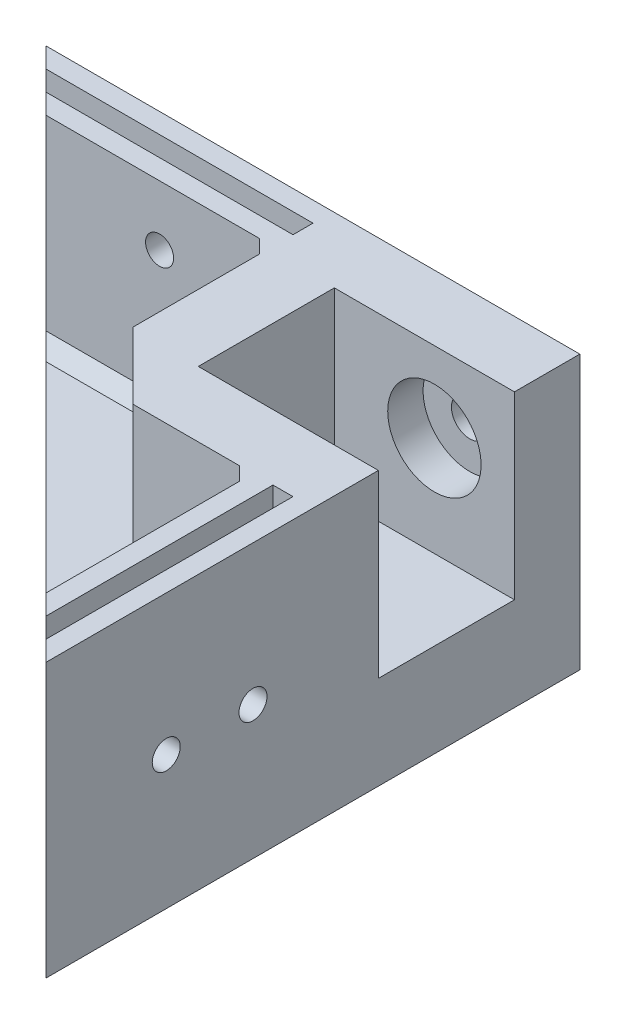
from build123d import *

# Parameters (mm, degrees)
SZKIC1_W                        = 37
SZKIC1_H                        = 30
DODANIE_WYCI_GNI_CIE1_DEPTH     = 40
SZKIC2_W                        = 27
SZKIC2_H                        = 20.4
WYTNIJ_WYCI_GNI_CIE1_DEPTH      = 30
WYTNIJ_WYCI_GNI_CIE2_DEPTH      = 15.5
WYTNIJ_WYCI_GNI_CIE2_DEPTH_BACK = 15.5
SZKIC3_R                        = 7
SZKIC4_R                        = 2.75
WYTNIJ_WYCI_GNI_CIE3_DEPTH      = 63.20128616
SZKIC5_W                        = 27
SZKIC5_H                        = 20.4
DODANIE_WYCI_GNI_CIE2_DEPTH     = 3
DODANIE_WYCI_GNI_CIE3_DEPTH     = 10
SZKIC8_W                        = 74
SZKIC8_H                        = 3
WYTNIJ_WYCI_GNI_CIE4_DEPTH      = 77
DODANIE_WYCI_GNI_CIE4_DEPTH     = 30
DODANIE_WYCI_GNI_CIE5_DEPTH     = 30
SZKIC11_R                       = 2.1
SZKIC11_R_2                     = 3.1
WYTNIJ_WYCI_GNI_CIE5_DEPTH      = 77
SZKIC12_R                       = 2.1
WYTNIJ_WYCI_GNI_CIE6_DEPTH      = 77
SFAZOWANIE2_SIZE                = 10
SFAZOWANIE3_SIZE                = 2
SZKIC13_R                       = 2.1
WYTNIJ_WYCI_GNI_CIE7_DEPTH      = 77
SZKIC14_R                       = 3.1
SZKIC14_R_2                     = 2.1
DODANIE_WYCI_GNI_CIE6_DEPTH     = 1


with BuildPart() as part:
    # Szkic1 → Dodanie-wyciągnięcie1 (new body)
    with BuildSketch(Plane.XY):
        with Locations((18.5, 15)):
            Rectangle(SZKIC1_W, SZKIC1_H)
    extrude(amount=DODANIE_WYCI_GNI_CIE1_DEPTH)

    # Szkic2 → Wytnij-wyciągnięcie1 (cut)
    with BuildSketch(Plane(origin=(0, 30, 0), x_dir=(1, 0, 0), z_dir=(0, 1, 0))):
        with Locations((23.5, -20)):
            Rectangle(SZKIC2_W, SZKIC2_H)
    extrude(amount=-WYTNIJ_WYCI_GNI_CIE1_DEPTH, mode=Mode.SUBTRACT)

    # Szkic3 → Wytnij-wyciągnięcie2 (cut, two sides: drawn at the far end of the back side and taken through both)
    with BuildSketch(Plane.XY.offset(20).offset(-WYTNIJ_WYCI_GNI_CIE2_DEPTH_BACK)):
        with Locations(Location((25, 18, 0), (0, 0, 180))):
            Circle(SZKIC3_R)
    extrude(amount=WYTNIJ_WYCI_GNI_CIE2_DEPTH + WYTNIJ_WYCI_GNI_CIE2_DEPTH_BACK, mode=Mode.SUBTRACT)

    # Szkic4 → Wytnij-wyciągnięcie3 (cut, through all)
    with BuildSketch(Plane(origin=(0, 0, 0), x_dir=(-1, 0, 0), z_dir=(0, 0, -1))):
        with Locations((-25, 18)):
            Circle(SZKIC4_R)
    extrude(amount=-WYTNIJ_WYCI_GNI_CIE3_DEPTH, mode=Mode.SUBTRACT)

    # Szkic5 → Dodanie-wyciągnięcie2 (add)
    with BuildSketch(Plane.XZ):
        with Locations((23.5, 20)):
            Rectangle(SZKIC5_W, SZKIC5_H)
    extrude(amount=-DODANIE_WYCI_GNI_CIE2_DEPTH)

    # Szkic6 → Dodanie-wyciągnięcie3 (add)
    with BuildSketch(Plane.XZ):
        Polygon((37, 0), (-43, 0), (37, 80), align=None)
    extrude(amount=DODANIE_WYCI_GNI_CIE3_DEPTH)

    # Szkic8 → Wytnij-wyciągnięcie4 (cut)
    with BuildSketch(Plane(origin=(0, 0, 80), x_dir=(-1, 0, 0), z_dir=(0, 0, -1))):
        with Locations((3, -5)):
            Rectangle(SZKIC8_W, SZKIC8_H)
    extrude(amount=WYTNIJ_WYCI_GNI_CIE4_DEPTH, mode=Mode.SUBTRACT)

    # Szkic9 → Dodanie-wyciągnięcie4 (add)
    with BuildSketch(Plane(origin=(0, 0, 0), x_dir=(1, 0, 0), z_dir=(0, 1, 0))):
        Polygon((0, 0), (-43, 0), (-40, -3), (0, -3), align=None)
        Polygon((0, -6), (0, -9), (-34, -9), (-37, -6), align=None)
    extrude(amount=DODANIE_WYCI_GNI_CIE4_DEPTH)

    # Szkic10 → Dodanie-wyciągnięcie5 (add)
    with BuildSketch(Plane(origin=(0, 0, 0), x_dir=(1, 0, 0), z_dir=(0, 1, 0))):
        Polygon((31, -74), (31, -40), (28, -40), (28, -71), align=None)
        Polygon((37, -80), (37, -40), (34, -40), (34, -77), align=None)
    extrude(amount=DODANIE_WYCI_GNI_CIE5_DEPTH)

    # Szkic11 → Wytnij-wyciągnięcie5 (cut)
    with BuildSketch(Plane(origin=(0, 0, 0), x_dir=(1, 0, 0), z_dir=(0, 1, 0))):
        with Locations((-7, -16)):
            Circle(SZKIC11_R)
        with Locations((21, -47)):
            Circle(SZKIC11_R_2)
    extrude(amount=-WYTNIJ_WYCI_GNI_CIE5_DEPTH, mode=Mode.SUBTRACT)

    # Szkic12 → Wytnij-wyciągnięcie6 (cut)
    with BuildSketch(Plane.XY.offset(9)):
        with Locations((-17, 21)):
            Circle(SZKIC12_R)
        with Locations((-17, 9)):
            Circle(SZKIC12_R)
    extrude(amount=-WYTNIJ_WYCI_GNI_CIE6_DEPTH, mode=Mode.SUBTRACT)

    # Sfazowanie2
    sfazowanie2_edges = [part.edges().sort_by_distance(p)[0] for p in [
        (0, 15, 40),
    ]]
    chamfer(sfazowanie2_edges, length=SFAZOWANIE2_SIZE)

    # Sfazowanie3
    # the kernel refuses this chamfer: 2 mm, written as the material it adds along each edge
    with BuildSketch(Plane(origin=(-1.333333333, 1.333333333, 10.333333333), x_dir=(0.7071067811865475, 0.7071067811865475, 0), z_dir=(0.5773502691896258, -0.5773502691896258, -0.5773502691896256))) as sfazowanie3_piece_1_section:
        Polygon((-1.414213562, 0.816496581), (1.414213562, 0.816496581), (0, -1.632993162), align=None)
    sfazowanie3_piece_1 = extrude(amount=2.540341184, mode=Mode.PRIVATE)
    sfazowanie3_piece_1 = split(sfazowanie3_piece_1, bisect_by=Plane(origin=(0, 0, 9), z_dir=(0, 1, 0)), keep=Keep.TOP, mode=Mode.PRIVATE)
    sfazowanie3_piece_1 = split(sfazowanie3_piece_1, bisect_by=Plane(origin=(0, 0, 9), z_dir=(-1, 0, 0)), keep=Keep.TOP, mode=Mode.PRIVATE)
    sfazowanie3_piece_1 = split(sfazowanie3_piece_1, bisect_by=Plane(origin=(0, 0, 9), z_dir=(0, 0, 1)), keep=Keep.TOP, mode=Mode.PRIVATE)
    add(sfazowanie3_piece_1)
    with BuildSketch(Plane(origin=(26.666666667, 1.333333333, 41.333333333), x_dir=(0, -0.7071067811865475, 0.7071067811865475), z_dir=(0.5773502691896257, -0.5773502691896258, -0.5773502691896258))) as sfazowanie3_piece_2_section:
        Polygon((-1.414213562, 0.816496581), (1.414213562, 0.816496581), (0, -1.632993162), align=None)
    sfazowanie3_piece_2 = extrude(amount=2.540341184, mode=Mode.PRIVATE)
    sfazowanie3_piece_2 = split(sfazowanie3_piece_2, bisect_by=Plane(origin=(28, 0, 40), z_dir=(0, 0, 1)), keep=Keep.TOP, mode=Mode.PRIVATE)
    sfazowanie3_piece_2 = split(sfazowanie3_piece_2, bisect_by=Plane(origin=(28, 0, 40), z_dir=(0, 1, 0)), keep=Keep.TOP, mode=Mode.PRIVATE)
    sfazowanie3_piece_2 = split(sfazowanie3_piece_2, bisect_by=Plane(origin=(28, 0, 40), z_dir=(-1, 0, 0)), keep=Keep.TOP, mode=Mode.PRIVATE)
    add(sfazowanie3_piece_2)
    with BuildSketch(Plane(origin=(0, -5.143365976, 9), x_dir=(0, 0, 1), z_dir=(0, 1, 0))) as sfazowanie3_piece_3_section:
        Polygon((SFAZOWANIE3_SIZE, 0), (0, -SFAZOWANIE3_SIZE), (0, 0), align=None)
    sfazowanie3_piece_3 = extrude(amount=35.143365976, mode=Mode.PRIVATE)
    sfazowanie3_piece_3 = split(sfazowanie3_piece_3, bisect_by=Plane(origin=(0, -3.5, 9), z_dir=(0, 1, 0)), keep=Keep.TOP, mode=Mode.PRIVATE)
    add(sfazowanie3_piece_3)
    with BuildSketch(Plane(origin=(5.143365976, 0, 9), x_dir=(0, 1, 0), z_dir=(-1, 0, 0))) as sfazowanie3_piece_4_section:
        Polygon((SFAZOWANIE3_SIZE, 0), (0, -SFAZOWANIE3_SIZE), (0, 0), align=None)
    sfazowanie3_piece_4 = extrude(amount=44.286731952, mode=Mode.PRIVATE)
    sfazowanie3_piece_4 = split(sfazowanie3_piece_4, bisect_by=Plane(origin=(-14.428317012, 0, 28.571682988), z_dir=(0.7071067811865476, 0, -0.7071067811865475)), keep=Keep.TOP, mode=Mode.PRIVATE)
    add(sfazowanie3_piece_4)
    with BuildSketch(Plane(origin=(28, -5.143365976, 40), x_dir=(-1, 0, 0), z_dir=(0, 1, 0))) as sfazowanie3_piece_5_section:
        Polygon((SFAZOWANIE3_SIZE, 0), (0, SFAZOWANIE3_SIZE), (0, 0), align=None)
    sfazowanie3_piece_5 = extrude(amount=35.143365976, mode=Mode.PRIVATE)
    sfazowanie3_piece_5 = sfazowanie3_piece_5 - Plane(origin=(25, 18, 40), x_dir=(-1, 0, 0), z_dir=(0, 0, -1)) * Cylinder(2.75, 79, mode=Mode.PRIVATE)
    sfazowanie3_piece_5 = split(sfazowanie3_piece_5, bisect_by=Plane(origin=(28, -3.5, 40), z_dir=(0, 1, 0)), keep=Keep.TOP, mode=Mode.PRIVATE)
    add(sfazowanie3_piece_5)
    with BuildSketch(Plane(origin=(28, 0, 34.856634024), x_dir=(0, 1, 0), z_dir=(0, 0, 1))) as sfazowanie3_piece_6_section:
        Polygon((SFAZOWANIE3_SIZE, 0), (0, SFAZOWANIE3_SIZE), (0, 0), align=None)
    sfazowanie3_piece_6 = extrude(amount=41.286731952, mode=Mode.PRIVATE)
    sfazowanie3_piece_6 = split(sfazowanie3_piece_6, bisect_by=Plane(origin=(9.928317012, 0, 52.928317012), z_dir=(0.7071067811865476, 0, -0.7071067811865475)), keep=Keep.TOP, mode=Mode.PRIVATE)
    add(sfazowanie3_piece_6)
    with BuildSketch(Plane(origin=(4.856634024, 0, 40), x_dir=(0, 1, 0), z_dir=(1, 0, 0))) as sfazowanie3_piece_7_section:
        Polygon((SFAZOWANIE3_SIZE, 0), (0, SFAZOWANIE3_SIZE), (0, 0), align=None)
    sfazowanie3_piece_7 = extrude(amount=28.286731952, mode=Mode.PRIVATE)
    sfazowanie3_piece_7 = split(sfazowanie3_piece_7, bisect_by=Plane(origin=(7.428317012, 0, 37.428317012), z_dir=(0.7071067811865476, 0, -0.7071067811865476)), keep=Keep.TOP, mode=Mode.PRIVATE)
    sfazowanie3_piece_7 = split(sfazowanie3_piece_7, bisect_by=Plane(origin=(31, 0, 40), z_dir=(-1, 0, 0)), keep=Keep.TOP, mode=Mode.PRIVATE)
    add(sfazowanie3_piece_7)
    with BuildSketch(Plane(origin=(0, 0, 3.856634024), x_dir=(0, 1, 0), z_dir=(0, 0, 1))) as sfazowanie3_piece_8_section:
        Polygon((SFAZOWANIE3_SIZE, 0), (0, SFAZOWANIE3_SIZE), (0, 0), align=None)
    sfazowanie3_piece_8 = extrude(amount=31.286731952, mode=Mode.PRIVATE)
    sfazowanie3_piece_8 = split(sfazowanie3_piece_8, bisect_by=Plane(origin=(-13.071682988, 0, 16.928317012), z_dir=(0.7071067811865476, 0, -0.7071067811865476)), keep=Keep.TOP, mode=Mode.PRIVATE)
    sfazowanie3_piece_8 = split(sfazowanie3_piece_8, bisect_by=Plane(origin=(0, 0, 6), z_dir=(0, 0, 1)), keep=Keep.TOP, mode=Mode.PRIVATE)
    add(sfazowanie3_piece_8)
    with BuildSketch(Plane(origin=(13.63690896, 0, 43.63690896), x_dir=(0, 1, 0), z_dir=(-0.7071067811865476, 0, -0.7071067811865476))) as sfazowanie3_piece_9_section:
        Polygon((SFAZOWANIE3_SIZE, 0), (0, -SFAZOWANIE3_SIZE), (0, 0), align=None)
    sfazowanie3_piece_9 = extrude(amount=24.428867576, mode=Mode.PRIVATE)
    sfazowanie3_piece_9 = split(sfazowanie3_piece_9, bisect_by=Plane(origin=(13.63690896, 0, 40), z_dir=(0, 0, -1)), keep=Keep.TOP, mode=Mode.PRIVATE)
    sfazowanie3_piece_9 = split(sfazowanie3_piece_9, bisect_by=Plane(origin=(0, 0, 43.63690896), z_dir=(1, 0, 0)), keep=Keep.TOP, mode=Mode.PRIVATE)
    add(sfazowanie3_piece_9)
    with BuildSketch(Plane(origin=(4.856634024, 0, 40), x_dir=(0, 1, 0), z_dir=(1, 0, 0))) as sfazowanie3_piece_10a_section:
        Polygon((SFAZOWANIE3_SIZE, 0), (0, SFAZOWANIE3_SIZE), (0, 0), align=None)
    sfazowanie3_piece_10a = extrude(amount=23.143365976, mode=Mode.PRIVATE)
    sfazowanie3_piece_10a = split(sfazowanie3_piece_10a, bisect_by=Plane(origin=(7.428317012, 0, 37.428317012), z_dir=(-0.7071067811865476, 0, 0.7071067811865476)), keep=Keep.TOP, mode=Mode.PRIVATE)
    with BuildSketch(Plane(origin=(13.63690896, 0, 43.63690896), x_dir=(0, 1, 0), z_dir=(-0.7071067811865476, 0, -0.7071067811865476))) as sfazowanie3_piece_10b_section:
        Polygon((SFAZOWANIE3_SIZE, 0), (0, -SFAZOWANIE3_SIZE), (0, 0), align=None)
    sfazowanie3_piece_10b = extrude(amount=24.428867576, mode=Mode.PRIVATE)
    sfazowanie3_piece_10b = split(sfazowanie3_piece_10b, bisect_by=Plane(origin=(13.63690896, 0, 40), z_dir=(0, 0, 1)), keep=Keep.TOP, mode=Mode.PRIVATE)
    sfazowanie3_piece_10 = sfazowanie3_piece_10a & sfazowanie3_piece_10b
    add(sfazowanie3_piece_10)
    with BuildSketch(Plane(origin=(13.63690896, 0, 43.63690896), x_dir=(0, 1, 0), z_dir=(-0.7071067811865476, 0, -0.7071067811865476))) as sfazowanie3_piece_11a_section:
        Polygon((SFAZOWANIE3_SIZE, 0), (0, -SFAZOWANIE3_SIZE), (0, 0), align=None)
    sfazowanie3_piece_11a = extrude(amount=24.428867576, mode=Mode.PRIVATE)
    sfazowanie3_piece_11a = split(sfazowanie3_piece_11a, bisect_by=Plane(origin=(0, 0, 43.63690896), z_dir=(-1, 0, 0)), keep=Keep.TOP, mode=Mode.PRIVATE)
    with BuildSketch(Plane(origin=(0, 0, 9), x_dir=(0, 1, 0), z_dir=(0, 0, 1))) as sfazowanie3_piece_11b_section:
        Polygon((SFAZOWANIE3_SIZE, 0), (0, SFAZOWANIE3_SIZE), (0, 0), align=None)
    sfazowanie3_piece_11b = extrude(amount=26.143365976, mode=Mode.PRIVATE)
    sfazowanie3_piece_11b = split(sfazowanie3_piece_11b, bisect_by=Plane(origin=(-10.5, 0, 19.5), z_dir=(-0.7071067811865476, 0, 0.7071067811865476)), keep=Keep.TOP, mode=Mode.PRIVATE)
    sfazowanie3_piece_11 = sfazowanie3_piece_11a & sfazowanie3_piece_11b
    add(sfazowanie3_piece_11)

    # Szkic13 → Wytnij-wyciągnięcie7 (cut)
    with BuildSketch(Plane.ZY.offset(-28)):
        with Locations((48.995840686, 9)):
            Circle(SZKIC13_R)
        with Locations((62, 9)):
            Circle(SZKIC13_R)
    extrude(amount=-WYTNIJ_WYCI_GNI_CIE7_DEPTH, mode=Mode.SUBTRACT)

    # Szkic14 → Dodanie-wyciągnięcie6 (add)
    with BuildSketch(Plane.XZ.offset(10)):
        Polygon((37, 0), (37, 80), (-43, 0), align=None)
        with Locations((21, 47)):
            Circle(SZKIC14_R, mode=Mode.SUBTRACT)
        with Locations((-7, 16)):
            Circle(SZKIC14_R_2, mode=Mode.SUBTRACT)
    extrude(amount=DODANIE_WYCI_GNI_CIE6_DEPTH)


solid = part.part
